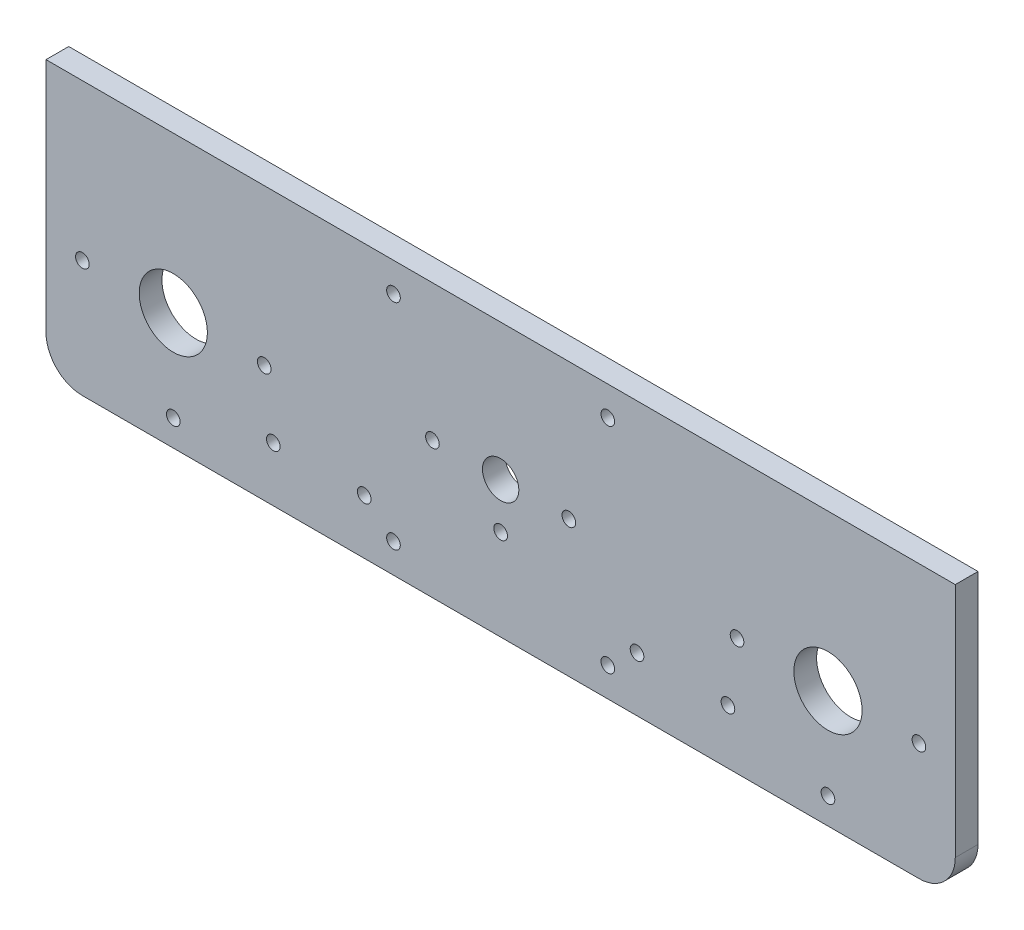
from build123d import *

# Parameters (mm, degrees)
CROQUIS1_R              = 1.5
CROQUIS1_R_2            = 7.5
CROQUIS1_R_3            = 4
SALIENTE_EXTRUIR1_DEPTH = 5


with BuildPart() as part:
    # Croquis1 → Saliente-Extruir1 (new body)
    with BuildSketch(Plane.XY):
        with BuildLine():
            Line((102.068487159, -49.327277931), (102.068487159, -12.327277931))
            Line((102.068487159, -12.327277931), (102.068487159, 2.672722069))
            Line((102.068487159, 2.672722069), (-97.931512841, 2.672722069))
            Line((-97.931512841, 2.672722069), (-97.931512841, -12.327277931))
            Line((-97.931512841, -12.327277931), (-97.931512841, -49.327277931))
            ThreePointArc((-97.931512841, -49.327277931), (-95.58836709, -54.98413218), (-89.931512841, -57.327277931))
            Line((-89.931512841, -57.327277931), (94.068487159, -57.327277931))
            ThreePointArc((94.068487159, -57.327277931), (99.725341409, -54.98413218), (102.068487159, -49.327277931))
        make_face()
        with Locations((-69.931512841, -51.577277931)):
            Circle(CROQUIS1_R, mode=Mode.SUBTRACT)
        with Locations((-47.931512841, -45.327277931)):
            Circle(CROQUIS1_R, mode=Mode.SUBTRACT)
        with Locations((-21.501512841, -50.897277931)):
            Circle(CROQUIS1_R, mode=Mode.SUBTRACT)
        with Locations((-27.931512841, -45.327277931)):
            Circle(CROQUIS1_R, mode=Mode.SUBTRACT)
        with Locations((-89.931512841, -31.577277931)):
            Circle(CROQUIS1_R, mode=Mode.SUBTRACT)
        with Locations((-69.931512841, -31.577277931)):
            Circle(CROQUIS1_R_2, mode=Mode.SUBTRACT)
        with Locations((-49.931512841, -31.577277931)):
            Circle(CROQUIS1_R, mode=Mode.SUBTRACT)
        with Locations((25.638487159, -50.897277931)):
            Circle(CROQUIS1_R, mode=Mode.SUBTRACT)
        with Locations((32.068487159, -45.327277931)):
            Circle(CROQUIS1_R, mode=Mode.SUBTRACT)
        with Locations((74.068487159, -51.577277931)):
            Circle(CROQUIS1_R, mode=Mode.SUBTRACT)
        with Locations((52.068487159, -45.327277931)):
            Circle(CROQUIS1_R, mode=Mode.SUBTRACT)
        with Locations((2.068487159, -37.327277931)):
            Circle(CROQUIS1_R, mode=Mode.SUBTRACT)
        with Locations((54.068487159, -31.577277931)):
            Circle(CROQUIS1_R, mode=Mode.SUBTRACT)
        with Locations((74.068487159, -31.577277931)):
            Circle(CROQUIS1_R_2, mode=Mode.SUBTRACT)
        with Locations((94.068487159, -31.577277931)):
            Circle(CROQUIS1_R, mode=Mode.SUBTRACT)
        with Locations((-12.931512841, -27.327277931)):
            Circle(CROQUIS1_R, mode=Mode.SUBTRACT)
        with Locations((-21.501512841, -3.757277931)):
            Circle(CROQUIS1_R, mode=Mode.SUBTRACT)
        with Locations((2.068487159, -27.327277931)):
            Circle(CROQUIS1_R_3, mode=Mode.SUBTRACT)
        with Locations((17.068487159, -27.327277931)):
            Circle(CROQUIS1_R, mode=Mode.SUBTRACT)
        with Locations((25.638487159, -3.757277931)):
            Circle(CROQUIS1_R, mode=Mode.SUBTRACT)
    extrude(amount=SALIENTE_EXTRUIR1_DEPTH)


solid = part.part
